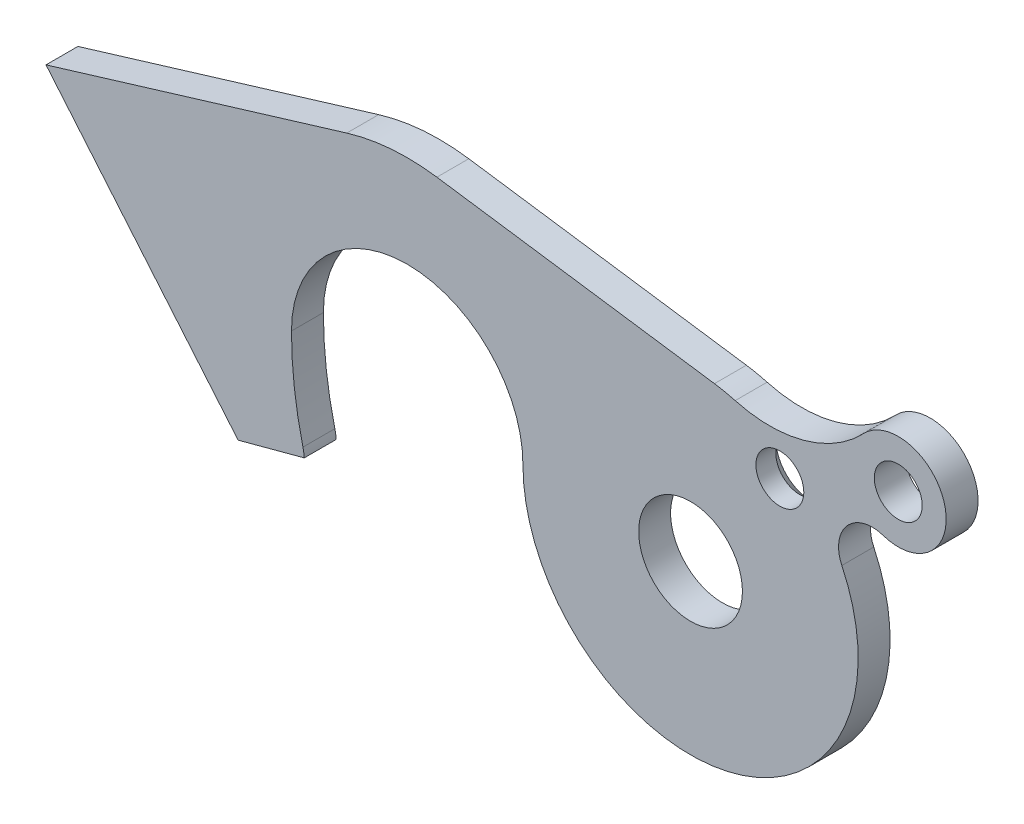
from build123d import *

# Parameters (mm, degrees)
SKETCH_1_R             = 3
SKETCH_1_R_2           = 6.5
SM_BASE_FLANGE_1_DEPTH = 4
CHAMFER_2_SIZE         = 1.5


# Sheet-metal steps are written as plain solids
with BuildPart() as part:
    # Sketch 1 → Базовая кромка1 (new body)
    with BuildSketch(Plane.XY):
        with BuildLine():
            Line((-31.781350826, 25.798136577), (2.996060756, 20.785177891))
            ThreePointArc((2.996060756, 20.785177891), (4.303188162, 20.554380838), (5.593123802, 20.241466502))
            ThreePointArc((5.593123802, 20.241466502), (14.252686638, 20.246803625), (21.67545772, 24.706683273))
            ThreePointArc((21.67545772, 24.706683273), (31.84775804, 22.028007779), (24.127078994, 14.883631579))
            ThreePointArc((24.127078994, 14.883631579), (19.607693171, 13.67003856), (18.956512096, 9.036074875))
            ThreePointArc((18.956512096, 9.036074875), (4.632129423, -20.482758042), (-21, 0))
            ThreePointArc((-21, 0), (-35.5, 14.5), (-50, 0))
            ThreePointArc((-50, 0), (-49.640340933, -5.986363846), (-48.566537916, -11.88660569))
            ThreePointArc((-48.566537916, -11.88660569), (-48.457937157, -12.423224233), (-48.39294532, -12.966850618))
            Line((-48.39294532, -12.966850618), (-56.68245323, -15.188017568))
            Line((-56.68245323, -15.188017568), (-80.754558191, 13.5))
            Line((-80.754558191, 13.5), (-43.07213712, 24.940628339))
            ThreePointArc((-43.07213712, 24.940628339), (-37.473872446, 25.989921702), (-31.781350826, 25.798136577))
        make_face()
        with Locations((11.189842551, 14.585216118)):
            Circle(SKETCH_1_R, mode=Mode.SUBTRACT)
        Circle(SKETCH_1_R_2, mode=Mode.SUBTRACT)
        with Locations((26.026325977, 20.575104227)):
            Circle(SKETCH_1_R, mode=Mode.SUBTRACT)
    extrude(amount=SM_BASE_FLANGE_1_DEPTH)

    # Фаска2
    chamfer_2_edges = [part.edges().sort_by_distance(p)[0] for p in [
        (8.189842551, 14.585216118, 0),
    ]]
    chamfer(chamfer_2_edges, length=CHAMFER_2_SIZE)


solid = part.part
